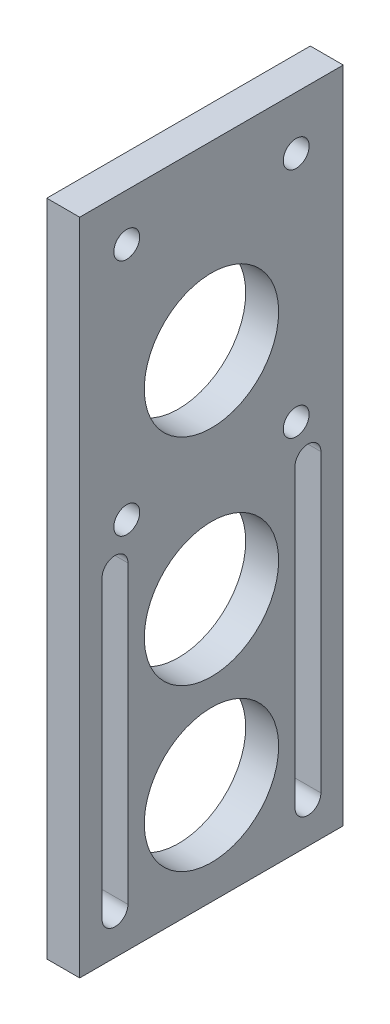
from build123d import *

# Parameters (mm, degrees)
SKETCH1_W           = 56
SKETCH1_H           = 140
BOSS_EXTRUDE1_DEPTH = 7
SKETCH2_R           = 14.275
CUT_EXTRUDE1_DEPTH  = 151.94701057
CUT_EXTRUDE2_DEPTH  = 151.94701057
SKETCH4_R           = 2.75
CUT_EXTRUDE3_DEPTH  = 151.94701057


with BuildPart() as part:
    # Sketch1 → Boss-Extrude1 (new body)
    with BuildSketch(Plane(origin=(0, 0, 0), x_dir=(0, 0, -1), z_dir=(1, 0, 0))):
        with Locations((28, 70)):
            Rectangle(SKETCH1_W, SKETCH1_H)
    extrude(amount=BOSS_EXTRUDE1_DEPTH)

    # Sketch2 → Cut-Extrude1 (cut, through all)
    with BuildSketch(Plane(origin=(7, 0, 0), x_dir=(0, 0, -1), z_dir=(1, 0, 0))):
        with Locations((28, 21.516289278)):
            Circle(SKETCH2_R)
        with Locations((28, 55.727598477)):
            Circle(SKETCH2_R)
        with Locations((28, 101.478526597)):
            Circle(SKETCH2_R)
    extrude(amount=-CUT_EXTRUDE1_DEPTH, mode=Mode.SUBTRACT)

    # Sketch3 → Cut-Extrude2 (cut, through all)
    with BuildSketch(Plane(origin=(7, 0, 0), x_dir=(0, 0, -1), z_dir=(1, 0, 0))):
        with BuildLine():
            Line((10.25, 71.244817418), (10.25, 8.434985259))
            ThreePointArc((10.25, 8.434985259), (7.5, 5.684985259), (4.75, 8.434985259))
            Line((4.75, 8.434985259), (4.75, 71.244817418))
            ThreePointArc((4.75, 71.244817418), (7.5, 73.994817418), (10.25, 71.244817418))
        make_face()
        with BuildLine():
            Line((45.75, 8.434985259), (45.75, 71.244817418))
            ThreePointArc((45.75, 71.244817418), (48.5, 73.994817418), (51.25, 71.244817418))
            Line((51.25, 71.244817418), (51.25, 8.434985259))
            ThreePointArc((51.25, 8.434985259), (48.5, 5.684985259), (45.75, 8.434985259))
        make_face()
    extrude(amount=-CUT_EXTRUDE2_DEPTH, mode=Mode.SUBTRACT)

    # Sketch4 → Cut-Extrude3 (cut, through all)
    with BuildSketch(Plane(origin=(7, 0, 0), x_dir=(0, 0, -1), z_dir=(1, 0, 0))):
        with Locations((10, 130)):
            Circle(SKETCH4_R)
        with Locations((46, 128.741828228)):
            Circle(SKETCH4_R)
        with Locations((46, 79.350819397)):
            Circle(SKETCH4_R)
        with Locations((10, 79.350819397)):
            Circle(SKETCH4_R)
    extrude(amount=-CUT_EXTRUDE3_DEPTH, mode=Mode.SUBTRACT)


solid = part.part
